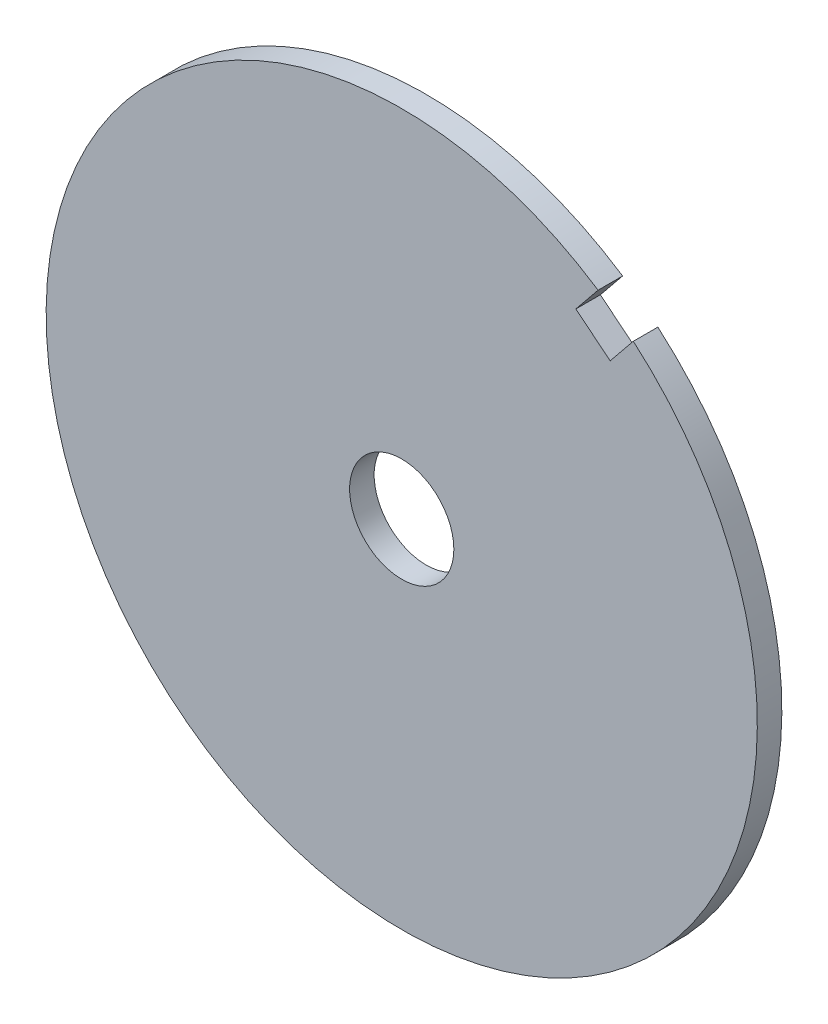
from build123d import *

# Parameters (mm, degrees)
SKETCH1_R               = 92.075
BOSS_EXTRUDE1_DEPTH     = 6.35
CUT_EXTRUDE1_REACH      = 132.368
SKETCH2_R               = 13.49375
CUT_EXTRUDE2_DEPTH      = 131.368453815
CUT_EXTRUDE2_DEPTH_BACK = 131.368453815


with BuildPart() as part:
    # Sketch1 → Boss-Extrude1 (new body)
    with BuildSketch(Plane.XY.offset(3372.777793208)):
        Circle(SKETCH1_R)
    extrude(amount=BOSS_EXTRUDE1_DEPTH)

    # Sketch2 → Cut-Extrude1 (cut, up to next)
    with BuildSketch(Plane.XY.offset(3379.127793208), mode=Mode.PRIVATE) as cut_extrude1_sk1:
        Circle(SKETCH2_R)
    cut_extrude1_tool1 = extrude(cut_extrude1_sk1.sketch, amount=-CUT_EXTRUDE1_REACH, mode=Mode.PRIVATE) & part.part
    add(cut_extrude1_tool1.solids().sort_by_distance((0, 0, 3379.127793))[0], mode=Mode.SUBTRACT)

    # Sketch3 → Cut-Extrude2 (cut, two sides: drawn at the far end of the back side and taken through both)
    with BuildSketch(Plane.XY.offset(3379.127793208).offset(-CUT_EXTRUDE2_DEPTH_BACK)):
        Polygon((337.093181537, 429.493915968), (50.845491886, 76.762891946), (45.092460053, 69.673672074), (53.967705575, 62.471247697), (59.96972589, 69.867285633), (346.217415541, 422.598309655), (893.997680173, 1147.41859237), (884.873446169, 1154.314198684), align=None)
    extrude(amount=CUT_EXTRUDE2_DEPTH + CUT_EXTRUDE2_DEPTH_BACK, mode=Mode.SUBTRACT)


solid = part.part
